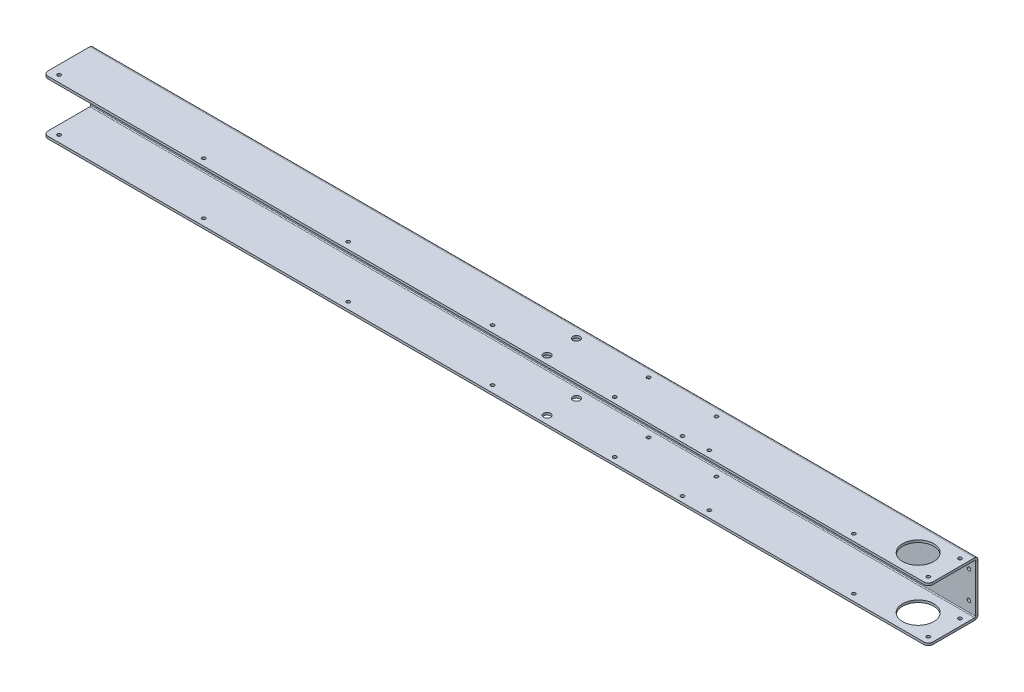
from build123d import *

# Parameters (mm, degrees)
SKETCH2_W                        = 1244.6
SKETCH2_H                        = 69.85
BASE_FLANGE1_DEPTH               = 3.2639
EDGE_FLANGE1_STRIP_W             = 15.5956
EDGE_FLANGE1_STRIP_H             = 3.2639
EDGE_FLANGE1_STRIP_CUT_DEPTH     = 1244.6
EDGE_FLANGE1_STRIP_2_W           = 15.5956
EDGE_FLANGE1_STRIP_2_H           = 3.2639
EDGE_FLANGE1_STRIP_CUT_2_DEPTH   = 1244.6
EDGE_FLANGE1_DEPTH               = 1244.6
EDGE_FLANGE1_BEND_DEPTH          = 1244.6
F_10_0_1935_DIAMETER_HOLE1_D     = 4.9149
SKETCH28_R                       = 21.87575
CUT_EXTRUDE1_DEPTH               = 631.49549328
F_10_0_1935_DIAMETER_HOLE5_D     = 4.9149
F_10_0_1935_DIAMETER_HOLE6_D     = 4.9149
F_10_0_1935_DIAMETER_HOLE7_D     = 4.9149
F_25_64_0_39063_DIAMETER_HOLE1_D = 9.922002
F_25_64_0_39063_DIAMETER_HOLE2_D = 9.922002
F_10_0_1935_DIAMETER_HOLE9_D     = 4.9149
LPATTERN1_COUNT                  = 13
LPATTERN1_PITCH                  = 101.6
FILLET3_R                        = 6.35
F_10_0_1935_DIAMETER_HOLE10_D    = 4.9149
F_10_0_1935_DIAMETER_HOLE11_D    = 4.9149


# Sheet-metal steps are written as plain solids
with BuildPart() as part:
    # Sketch2 → Base-Flange1 (new body)
    with BuildSketch(Plane.XY):
        Rectangle(SKETCH2_W, SKETCH2_H)
    extrude(amount=-BASE_FLANGE1_DEPTH)

    # Edge-Flange1 strip (across the edge) → Edge-Flange1 strip cut (cut)
    with BuildSketch(Plane(origin=(622.3, 34.925, 0), x_dir=(0, -1, 0), z_dir=(-1, 0, 0))):
        with Locations((-6.5278, -1.63195)):
            Rectangle(EDGE_FLANGE1_STRIP_W, EDGE_FLANGE1_STRIP_H)
    extrude(amount=EDGE_FLANGE1_STRIP_CUT_DEPTH, mode=Mode.SUBTRACT)

    # Edge-Flange1 strip 2 (across the edge) → Edge-Flange1 strip cut 2 (cut)
    with BuildSketch(Plane(origin=(-622.3, -34.925, 0), x_dir=(0, 1, 0), z_dir=(1, 0, 0))):
        with Locations((-6.5278, -1.63195)):
            Rectangle(EDGE_FLANGE1_STRIP_2_W, EDGE_FLANGE1_STRIP_2_H)
    extrude(amount=EDGE_FLANGE1_STRIP_CUT_2_DEPTH, mode=Mode.SUBTRACT)

    # Edge-Flange1 section (across the edge) → Edge-Flange1 (add)
    with BuildSketch(Plane(origin=(622.3, 34.925, 0), x_dir=(0, -1, 0), z_dir=(-1, 0, 0))):
        with BuildLine():
            Line((-3.2639, 1.27), (-3.2639, 66.5861))
            Line((-3.2639, 66.5861), (0, 66.5861))
            Line((0, 66.5861), (0, 1.27))
            ThreePointArc((0, 1.27), (0.371974388, 0.371974388), (1.27, 0))
            Line((1.27, 0), (1.27, -3.2639))
            ThreePointArc((1.27, -3.2639), (-1.935951435, -1.935951435), (-3.2639, 1.27))
        make_face()
    extrude(amount=EDGE_FLANGE1_DEPTH)

    # Edge-Flange1 section 2 (across the edge) → Edge-Flange1 bend (add)
    with BuildSketch(Plane(origin=(-622.3, -34.925, 0), x_dir=(0, 1, 0), z_dir=(1, 0, 0))):
        with BuildLine():
            Line((-3.2639, 1.27), (-3.2639, 66.5861))
            Line((-3.2639, 66.5861), (0, 66.5861))
            Line((0, 66.5861), (0, 1.27))
            ThreePointArc((0, 1.27), (0.371974388, 0.371974388), (1.27, 0))
            Line((1.27, 0), (1.27, -3.2639))
            ThreePointArc((1.27, -3.2639), (-1.935951435, -1.935951435), (-3.2639, 1.27))
        make_face()
    extrude(amount=EDGE_FLANGE1_BEND_DEPTH)

    # #10 (0.1935) Diameter Hole1 (through all)
    with Locations(Plane(origin=(0, 0, -3.2639), x_dir=(-1, 0, 0), z_dir=(0, 0, -1))):
        with Locations((552.45, 22.225), (603.25, 22.225), (603.25, -22.225), (552.45, -22.225), (501.65, -22.225), (501.65, 22.225)):
            Hole(F_10_0_1935_DIAMETER_HOLE1_D / 2)

    # Sketch28 → Cut-Extrude1 (cut, through all)
    with BuildSketch(Plane.XZ.offset(38.1889)):
        with Locations(Location((576.2625, 34.8361, 0), (0, 0, 270))):
            Circle(SKETCH28_R)
    extrude(amount=-CUT_EXTRUDE1_DEPTH, mode=Mode.SUBTRACT)

    # #10 (0.1935) Diameter Hole5 (through all)
    with Locations(Plane(origin=(0, -38.1889, 0), x_dir=(-1, 0, 0), z_dir=(0, -1, 0))):
        with Locations((-173.38675, -58.6486), (-173.38675, -11.0236), (-268.63675, -58.6486), (-268.63675, -11.0236)):
            Hole(F_10_0_1935_DIAMETER_HOLE5_D / 2)

    # #10 (0.1935) Diameter Hole6 (through all)
    with Locations(Plane(origin=(0, 0, -3.2639), x_dir=(-1, 0, 0), z_dir=(0, 0, -1))):
        with Locations((-233.71175, 22.225), (-208.31175, 22.225), (-208.31175, -22.225), (-233.71175, -22.225)):
            Hole(F_10_0_1935_DIAMETER_HOLE6_D / 2)

    # #10 (0.1935) Diameter Hole7 (through all)
    with Locations(Plane(origin=(0, 0, -3.2639), x_dir=(-1, 0, 0), z_dir=(0, 0, -1))):
        with Locations((463.55, 0), (368.3, 0)):
            Hole(F_10_0_1935_DIAMETER_HOLE7_D / 2)

    # 25/64 (0.39063) Diameter Hole1 (through all)
    with Locations(Plane(origin=(0, 0, -3.2639), x_dir=(-1, 0, 0), z_dir=(0, 0, -1))):
        with Locations((44.41825, -20.6375), (44.41825, 20.6375)):
            Hole(F_25_64_0_39063_DIAMETER_HOLE1_D / 2)

    # 25/64 (0.39063) Diameter Hole2 (through all)
    with Locations(Plane(origin=(0, 38.1889, 0), x_dir=(1, 0, 0), z_dir=(0, 1, 0))):
        with Locations((75.05065, -14.1986), (75.05065, -55.4736)):
            Hole(F_25_64_0_39063_DIAMETER_HOLE2_D / 2)

    # #10 (0.1935) Diameter Hole9 (through all)
    with Locations(Plane(origin=(0, -38.1889, 0), x_dir=(-1, 0, 0), z_dir=(0, -1, 0))):
        with Locations((609.6, -57.0611)):
            f_10_0_1935_diameter_hole9 = Hole(F_10_0_1935_DIAMETER_HOLE9_D / 2)

    # LPattern1: #10 (0.1935) Diameter Hole9 ×13, 7 skipped
    with Locations(*[(i * LPATTERN1_PITCH, 0, 0) for i in range(1, LPATTERN1_COUNT) if i not in (1, 3, 5, 7, 8, 10, 12)]):
        add(f_10_0_1935_diameter_hole9, mode=Mode.SUBTRACT)

    # Fillet3
    fillet3_edges = [part.edges().sort_by_distance(p)[0] for p in [
        (622.3, 36.55695, 66.5861),
        (-622.3, 36.55695, 66.5861),
        (-622.3, -36.55695, 66.5861),
        (622.3, -36.55695, 66.5861),
    ]]
    fillet(fillet3_edges, radius=FILLET3_R)

    # #10 (0.1935) Diameter Hole10 (through all)
    with Locations(Plane(origin=(0, 38.1889, 0), x_dir=(1, 0, 0), z_dir=(0, 1, 0))):
        with Locations((612.775, -12.6111), (612.775, -57.0611)):
            Hole(F_10_0_1935_DIAMETER_HOLE10_D / 2)

    # #10 (0.1935) Diameter Hole11 (through all)
    with Locations(Plane(origin=(0, 0, -3.2639), x_dir=(-1, 0, 0), z_dir=(0, 0, -1))):
        with Locations((-612.775, 19.05), (-612.775, -19.05)):
            Hole(F_10_0_1935_DIAMETER_HOLE11_D / 2)


solid = part.part
